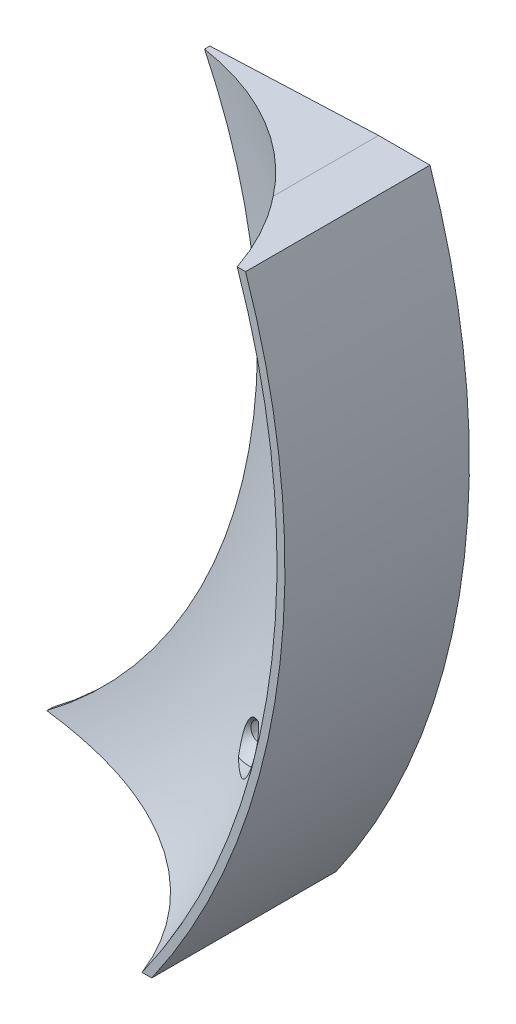
from build123d import *

# Parameters (mm, degrees)
BOSS_EXTRUDE1_DEPTH  = 44.45
CUT_SWEEP2_PROFILE_R = 63.5


# Read off the part's stored shape, not the designer's step: #10 (0.1935) Diameter Hole2
with BuildPart() as part:
    # Sketch1 → Boss-Extrude1 (new body)
    with BuildSketch(Plane.XY):
        with BuildLine():
            ThreePointArc((114.233948766, 55.494188428), (123.433861724, -29.884473893), (76.2, -101.6))
            Line((76.2, -101.6), (130.136274728, -101.6))
            ThreePointArc((130.136274728, -101.6), (163.128273679, -25.439660506), (154.893148654, 57.15))
            Line((154.893148654, 57.15), (114.233948766, 55.494188428))
        make_face()
        with BuildLine():
            ThreePointArc((154.893148654, 57.15), (163.128273679, -25.439660506), (130.136274728, -101.6))
            Line((130.136274728, -101.6), (144.672121212, -101.6))
            ThreePointArc((144.672121212, -101.6), (175.016349172, -24.937124506), (167.291542392, 57.15))
            Line((167.291542392, 57.15), (154.893148654, 57.15))
        make_face()
    extrude(amount=BOSS_EXTRUDE1_DEPTH)

    # Cut-Sweep2: sweep along a path in Sketch77
    with BuildLine(Plane.XY.offset(63.5)) as cut_sweep2_path:
        ThreePointArc((52.363441445, -101.6), (109.396263278, -33.120198984), (99.924396675, 55.494188428))
    # Cut-Sweep2 profile (on start of the path) → Cut-Sweep2 (sweep, cut)
    with BuildSketch(Plane(origin=(52.363441445, -101.6, 63.5), x_dir=(-0.45812284729085156, 0.8888888888888887, 0), z_dir=(0.8888888888888887, 0.45812284729085156, 0))):
        Circle(CUT_SWEEP2_PROFILE_R)
    sweep(path=cut_sweep2_path.line, mode=Mode.SUBTRACT)

    # #10 (0.1935) Diameter Hole2 outline → #10 (0.1935) Diameter Hole2 (revolve, cut)
    with BuildSketch(Plane(origin=(138.444039196, -69.85, 0), x_dir=(1, 0, 0), z_dir=(0, -1, 0))):
        Polygon((5.3975, 19.899272047), (0, 19.899272047), (0, 0), (2.45745, 0), (2.45745, 11.874205567), (5.3975, 14.814255567), align=None)
    revolve(axis=Axis((138.444039196, -69.85, 0), (0, 0, 1)), mode=Mode.SUBTRACT)

    # 10 _0.1935_ Diameter Hole2 2 outline → 10 _0.1935_ Diameter Hole2 2 (revolve, cut)
    with BuildSketch(Plane(origin=(152.972593915, -25.4, 0), x_dir=(1, 0, 0), z_dir=(0, -1, 0))):
        Polygon((5.3975, 14.814255556), (5.3975, 19.899272047), (0, 19.899272047), (0, 0), (2.45745, 0), (2.45745, 11.874205567), align=None)
    revolve(axis=Axis((152.972593915, -25.4, 0), (0, 0, 1)), mode=Mode.SUBTRACT)

    # 10 _0.1935_ Diameter Hole2 3 outline → 10 _0.1935_ Diameter Hole2 3 (revolve, cut)
    with BuildSketch(Plane(origin=(152.972593915, 25.4, 0), x_dir=(1, 0, 0), z_dir=(0, -1, 0))):
        Polygon((5.3975, 14.814255556), (5.3975, 19.899272047), (0, 19.899272047), (0, 0), (2.45745, 0), (2.45745, 11.874205567), align=None)
    revolve(axis=Axis((152.972593915, 25.4, 0), (0, 0, 1)), mode=Mode.SUBTRACT)


solid = part.part
